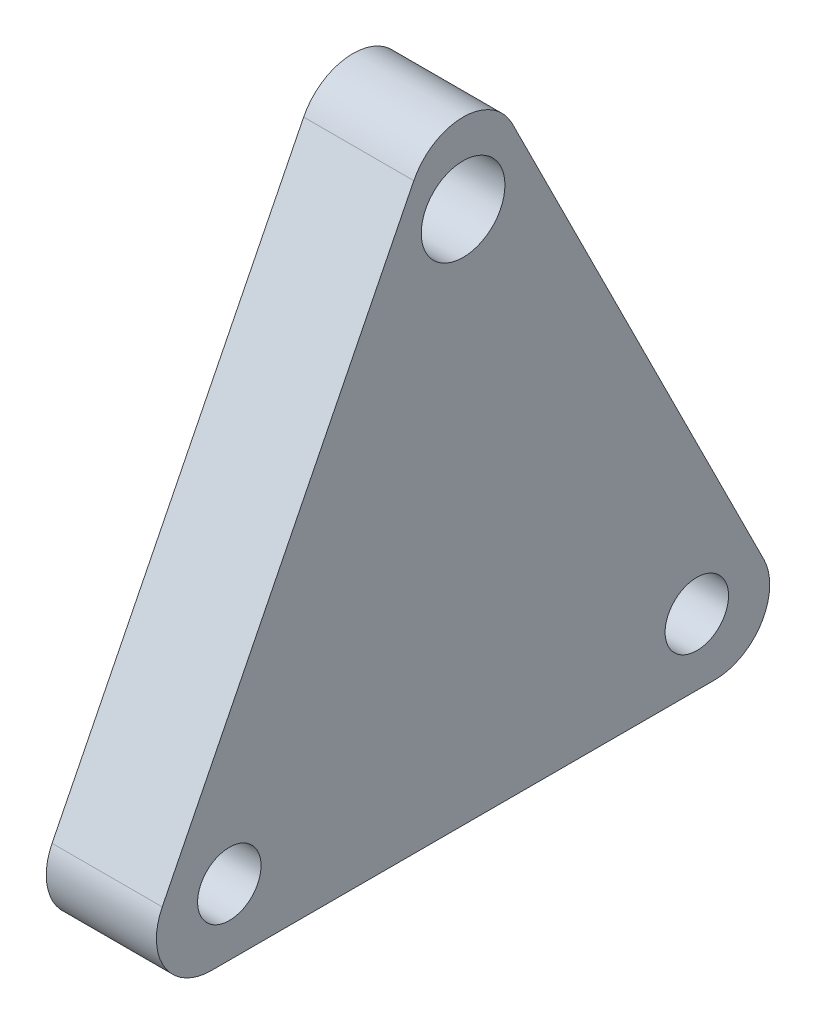
from build123d import *

# Parameters (mm, degrees)
SKETCH1_R           = 1.8288
SKETCH1_R_2         = 2.413
BOSS_EXTRUDE1_DEPTH = 6.35
FILLET1_R           = 3.175


with BuildPart() as part:
    # Sketch1 → Boss-Extrude1 (new body)
    with BuildSketch(Plane(origin=(0, 0, 0), x_dir=(0, 0, -1), z_dir=(1, 0, 0))):
        Polygon((19.639409497, -3.81), (-19.639409497, -3.81), (0, 35.468818994), align=None)
        with Locations((-13.4747, 0)):
            Circle(SKETCH1_R, mode=Mode.SUBTRACT)
        with Locations((0, 26.9494)):
            Circle(SKETCH1_R_2, mode=Mode.SUBTRACT)
        with Locations((13.4747, 0)):
            Circle(SKETCH1_R, mode=Mode.SUBTRACT)
    extrude(amount=BOSS_EXTRUDE1_DEPTH)

    # Fillet1
    fillet1_edges = [part.edges().sort_by_distance(p)[0] for p in [
        (3.175, 35.468818994, 0),
        (3.175, -3.81, -19.639409497),
        (3.175, -3.81, 19.639409497),
    ]]
    fillet(fillet1_edges, radius=FILLET1_R)


solid = part.part
